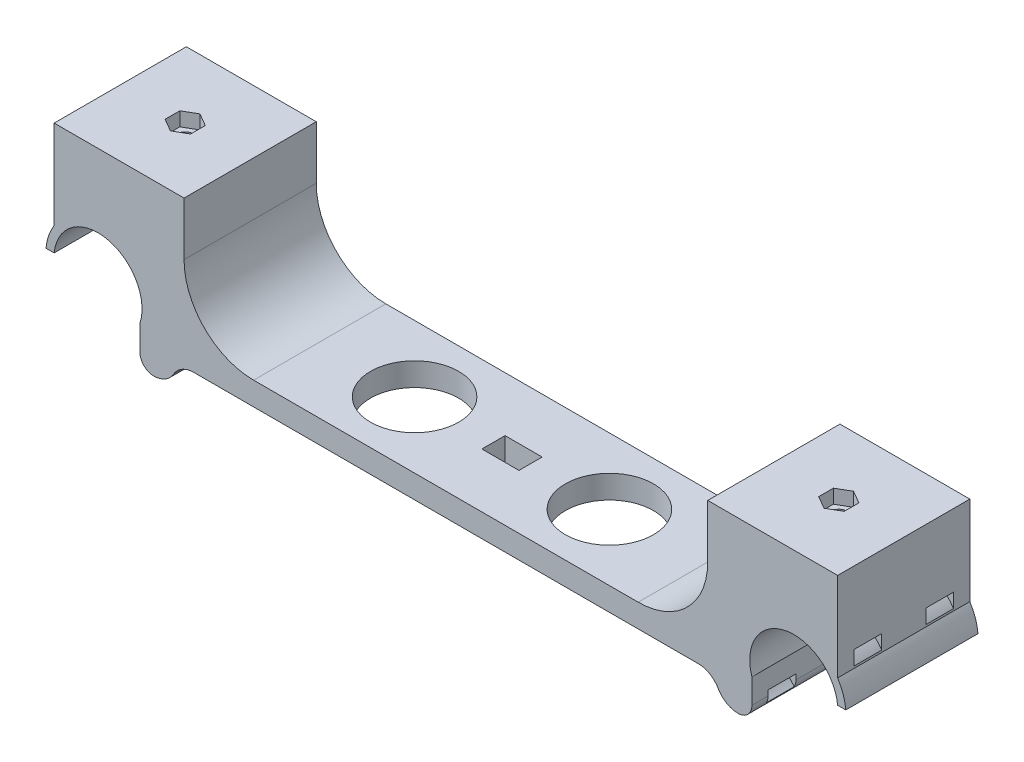
from build123d import *

# Parameters (mm, degrees)
BOSS_EXTRUDE3_DEPTH = 28.5
FILLET1_R           = 15
SKETCH8_R           = 9.5
SKETCH8_W           = 8
SKETCH8_H           = 5
CUT_EXTRUDE4_DEPTH  = 10
SKETCH10_R          = 1.75
CUT_EXTRUDE6_DEPTH  = 10
CUT_EXTRUDE9_DEPTH  = 3
SKETCH17_W          = 6
SKETCH17_H          = 2
CUT_EXTRUDE11_DEPTH = 49
FILLET2_R           = 3
CUT_EXTRUDE12_START = -28.5
CUT_EXTRUDE12_DEPTH = 28.5
FILLET3_R           = 5
FILLET4_R           = 5
FILLET5_START       = -1
FILLET5_DEPTH       = 30


with BuildPart() as part:
    # Sketch7 → Boss-Extrude3 (new body)
    with BuildSketch(Plane.XY):
        with BuildLine():
            Line((-75, 0), (75, 0))
            ThreePointArc((75, 0), (82.593171274, 2.949021142), (86.205467416, 10.25))
            Line((86.205467416, 10.25), (84.447221814, 10.25))
            ThreePointArc((84.447221814, 10.25), (65.5, 11.25), (84.447221814, 12.25))
            Line((84.447221814, 12.25), (86.205467416, 12.25))
            ThreePointArc((86.205467416, 12.25), (85.637542957, 14.911308486), (84.447221814, 17.358395861))
            Line((84.447221814, 17.358395861), (84.447221814, 36.5))
            Line((84.447221814, 36.5), (56.447221814, 36.5))
            Line((56.447221814, 36.5), (56.447221814, 10))
            Line((56.447221814, 10), (-56.447221814, 10))
            Line((-56.447221814, 10), (-56.447221814, 36.5))
            Line((-56.447221814, 36.5), (-84.447221814, 36.5))
            Line((-84.447221814, 36.5), (-84.447221814, 17.358395861))
            ThreePointArc((-84.447221814, 17.358395861), (-85.637542957, 14.911308486), (-86.205467416, 12.25))
            Line((-86.205467416, 12.25), (-84.447221814, 12.25))
            ThreePointArc((-84.447221814, 12.25), (-65.5, 11.25), (-84.447221814, 10.25))
            Line((-84.447221814, 10.25), (-86.205467416, 10.25))
            ThreePointArc((-86.205467416, 10.25), (-82.593171274, 2.949021142), (-75, 0))
        make_face()
    extrude(amount=BOSS_EXTRUDE3_DEPTH)

    # Fillet1
    fillet1_edges = [part.edges().sort_by_distance(p)[0] for p in [
        (-56.447221814, 10, 14.25),
        (56.447221814, 10, 14.25),
    ]]
    fillet(fillet1_edges, radius=FILLET1_R)

    # Sketch8 → Cut-Extrude4 (cut)
    with BuildSketch(Plane(origin=(0, 10, 0), x_dir=(1, 0, 0), z_dir=(0, 1, 0))):
        with Locations(Location((21, -14.25, 0), (0, 0, 270))):
            Circle(SKETCH8_R)
        with Locations(Location((-21, -14.25, 0), (0, 0, 270))):
            Circle(SKETCH8_R)
        with Locations((0, -14.25)):
            Rectangle(SKETCH8_W, SKETCH8_H)
    extrude(amount=-CUT_EXTRUDE4_DEPTH, mode=Mode.SUBTRACT)

    # Sketch10 → Cut-Extrude6 (cut)
    with BuildSketch(Plane(origin=(0, 36.5, 0), x_dir=(1, 0, 0), z_dir=(0, 1, 0))):
        with Locations(Location((70.447221814, -14.25, 0), (0, 0, 180))):
            Circle(SKETCH10_R)
        with Locations(Location((-70.447221814, -14.25, 0), (0, 0, 180))):
            Circle(SKETCH10_R)
    extrude(amount=-CUT_EXTRUDE6_DEPTH, mode=Mode.SUBTRACT)

    # Sketch13 → Cut-Extrude9 (cut)
    with BuildSketch(Plane(origin=(0, 36.5, 0), x_dir=(1, 0, 0), z_dir=(0, 1, 0))):
        Polygon((67.697221814, -12.66228676), (67.697221814, -15.83771324), (70.447221814, -17.425426481), (73.197221814, -15.83771324), (73.197221814, -12.66228676), (70.447221814, -11.074573519), align=None)
        Polygon((-70.447221814, -17.425426481), (-67.697221814, -15.83771324), (-67.697221814, -12.66228676), (-70.447221814, -11.074573519), (-73.197221814, -12.66228676), (-73.197221814, -15.83771324), align=None)
    extrude(amount=-CUT_EXTRUDE9_DEPTH, mode=Mode.SUBTRACT)

    # Sketch17 → Cut-Revolve1 (revolve, cut)
    with BuildSketch(Plane.ZY.offset(-75)):
        with Locations((22, 23.75)):
            Rectangle(SKETCH17_W, SKETCH17_H)
        with Locations((6.5, 23.75)):
            Rectangle(SKETCH17_W, SKETCH17_H)
    cut_revolve1 = revolve(axis=Axis((75, 11.25, 28.5), (0, 0, -1)), mode=Mode.SUBTRACT)

    # Mirror1: Cut-Revolve1 across plane
    add(cut_revolve1.mirror(Plane(origin=(0, 0, 0), x_dir=(0, 0, 1), z_dir=(1, 0, 0))), mode=Mode.SUBTRACT)

    # Sketch18 → Cut-Extrude11 (cut)
    with BuildSketch(Plane.XY.offset(28.5)):
        Polygon((-75, 11.25), (-65.964963095, 8.314338553), (-65.964963095, 0), (-86.964963095, 0), (-86.964963095, 11.25), align=None)
        Polygon((86.964963095, 11.25), (75, 11.25), (65.964963095, 8.314338553), (65.964963095, 0), (86.964963095, 0), align=None)
    extrude(amount=-CUT_EXTRUDE11_DEPTH, mode=Mode.SUBTRACT)

    # Fillet2
    # the kernel refuses this fillet: 3 mm, written as the material it takes off along each edge
    with BuildSketch(Plane(origin=(-65.964963095, 0, 36), x_dir=(1, 0, 0), z_dir=(0, 0, -1)), Plane(origin=(65.964963095, 0, 36), x_dir=(0, 1, 0), z_dir=(0, 0, -1))) as fillet2_piece_1:
        with BuildLine():
            CenterArc((FILLET2_R, -FILLET2_R), FILLET2_R, 90, 90)
            Line((0, -FILLET2_R), (0, 0))
            Line((0, 0), (FILLET2_R, 0))
        make_face()
    extrude(amount=43.5, mode=Mode.SUBTRACT)

    # Sketch20 → Cut-Extrude12 (cut)
    with BuildSketch(Plane.XY.offset(28.5).offset(CUT_EXTRUDE12_START)):
        with BuildLine():
            Line((57.587719851, 5), (-57.587719851, 5))
            ThreePointArc((-57.587719851, 5), (-58.757162737, 2.39447982), (-60.313696857, 0))
            Line((-60.313696857, 0), (60.313696857, 0))
            ThreePointArc((60.313696857, 0), (58.757162737, 2.39447982), (57.587719851, 5))
        make_face()
    extrude(amount=CUT_EXTRUDE12_DEPTH, mode=Mode.SUBTRACT)

    # Fillet3
    # the kernel refuses this fillet: 5 mm, written as the material it takes off along each edge
    with BuildSketch(Plane(origin=(-60.313696857, 0, -7.959028746), x_dir=(0.5375468252695589, 0.8432339003162873, 0), z_dir=(0, 0, 1))) as fillet3_piece_1:
        with BuildLine():
            CenterArc((2.753393728, 4.981456882), FILLET3_R, 213.309669326, 61.62636665)
            Line((-1.425179749, 2.235637571), (-1.508751219, 2.180721184))
            ThreePointArc((-1.508751219, 2.180721184), (-0.796913265, 1.064064103), (-0.08432339, -0.053754683))
            Line((-0.08432339, -0.053754683), (-0.008604355, -0.099629138))
            ThreePointArc((-0.008604355, -0.099629138), (1.591805749, -0.168609535), (3.192215854, -0.099629138))
            Line((3.192215854, -0.099629138), (3.183611498, 0))
        make_face()
    extrude(amount=44.418057492, mode=Mode.SUBTRACT)

    # Fillet4
    fillet4_edges = [part.edges().sort_by_distance(p)[0] for p in [
        (-57.587719851, 5, 14.25),
        (57.587719851, 5, 14.25),
    ]]
    fillet(fillet4_edges, radius=FILLET4_R)

    # Fillet5: read off the stored shape, not the designer's step
    # Fillet5 outline → Fillet5 (cut)
    with BuildSketch(Plane.XY.offset(FILLET5_START)):
        with BuildLine():
            ThreePointArc((62.964963095, 0), (60.500818254, 0.685449294), (58.69804707, 2.499799478))
            ThreePointArc((58.69804707, 2.499799478), (58.728163344, 2.446889634), (58.757633161, 2.393617021))
            ThreePointArc((58.757633161, 2.393617021), (59.489422728, 1.16674692), (60.313696857, 0))
            Line((60.313696857, 0), (62.964963095, 0))
        make_face()
    extrude(amount=FILLET5_DEPTH, mode=Mode.SUBTRACT)


solid = part.part
